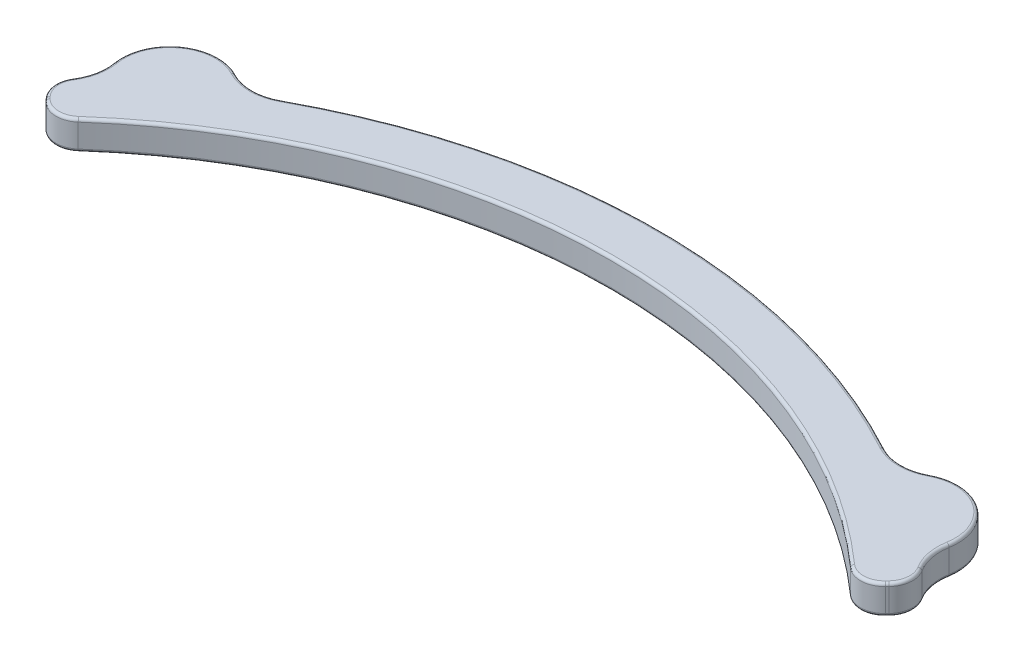
from build123d import *

# Parameters (mm, degrees)
EXTRUDE_1_DEPTH = 3
EXTRUDE_2_DEPTH = 3
FILLET_3_R      = 5
FILLET_1_R      = 2.5
FILLET_2_R      = 0.3


with BuildPart() as part:
    # Эскиз1 → Бобышка-Вытянуть1 (new body)
    with BuildSketch(Plane(origin=(0, 0, 0), x_dir=(1, 0, 0), z_dir=(0, 1, 0))):
        with BuildLine():
            Line((-45, 46.904157598234306), (-41.53846153846153, 43.29614547529319))
            ThreePointArc((-41.53846153846153, 43.29614547529319), (3.67e-15, 60), (41.53846153846155, 43.29614547529319))
            Line((41.53846153846155, 43.29614547529319), (45, 46.904157598234306))
            ThreePointArc((45, 46.904157598234306), (3.98e-15, 65.00000000000001), (-45, 46.904157598234306))
        make_face()
    extrude(amount=EXTRUDE_1_DEPTH)

    # Эскиз2 → Бобышка-Вытянуть2 (add)
    with BuildSketch(Plane(origin=(0, 3, 0), x_dir=(1, 0, 0), z_dir=(0, 1, 0))):
        with BuildLine():
            Line((-42.02974987239072, 49.583264572477226), (-33.93309379020482, 55.439563001751424))
            ThreePointArc((-33.93309379020482, 55.439563001751424), (-41.02444375843438, 56.71855969884159), (-42.02974987239072, 49.583264572477226))
        make_face()
    extrude_2 = extrude(amount=-EXTRUDE_2_DEPTH)

    # Зеркальное отражение1: Бобышка-Вытянуть2 across plane
    add(extrude_2.mirror(Plane(origin=(0, 0, 0), x_dir=(0, 0, 1), z_dir=(1, 0, 0))))

    # Скругление3
    fillet_3_edges = [part.edges().sort_by_distance(p)[0] for p in [
        (-42.02974987239072, 1.5, -49.583264572477226),
        (-33.93309379020482, 1.5, -55.439563001751424),
        (42.02974987239072, 1.5, -49.583264572477226),
        (33.93309379020482, 1.5, -55.439563001751424),
    ]]
    fillet(fillet_3_edges, radius=FILLET_3_R)

    # Скругление1
    fillet_1_edges = [part.edges().sort_by_distance(p)[0] for p in [
        (-45.00000000000001, 1.5, -46.904157598234306),
        (-41.53846153846153, 1.5, -43.29614547529319),
        (45, 1.5, -46.904157598234306),
        (41.53846153846155, 1.5, -43.29614547529319),
    ]]
    fillet(fillet_1_edges, radius=FILLET_1_R - 0.0001)  # a hair under: the kernel refuses the full size

    # Скругление2
    fillet_2_edges = [part.edges().sort_by_distance(p)[0] for p in [
        (41.02444375843438, 0, -56.71855969884159),
        (41.02444375843438, 3, -56.71855969884159),
        (7.11e-15, 0, -65.00000000000001),
        (7.11e-15, 3, -65.00000000000001),
        (-41.02444375843439, 0, -56.71855969884159),
        (-41.02444375843439, 3, -56.71855969884159),
        (43.05092646297095, 0, -50.01169135950295),
        (33.39115614651435, 3, -56.5073672828282),
        (33.39115614651436, 0, -56.5073672828282),
        (-33.39115614651442, 3, -56.507367282828206),
        (-33.39115614651442, 0, -56.507367282828206),
        (-43.05092646297095, 3, -50.01169135950294),
        (-43.32649192788036, 0, -45.15983567919837),
        (-43.32649192788036, 3, -45.15983567919837),
        (43.32649192788038, 0, -45.15983567919839),
        (0, 0, -60),
        (-43.05092646297095, 0, -50.01169135950294),
        (41.53237029407291, 0, -44.296859977676405),
        (44.10182670999084, 0, -46.73582398498882),
        (-41.532370294072905, 0, -44.29685997767639),
        (-44.10182670999084, 0, -46.7358239849889),
        (43.050926462970956, 3, -50.01169135950295),
        (0, 3, -60),
        (43.32649192788038, 3, -45.15983567919839),
        (41.53237029407291, 3, -44.296859977676405),
        (44.10182670999084, 3, -46.73582398498882),
        (-41.532370294072905, 3, -44.29685997767639),
        (-44.10182670999083, 3, -46.735823984988905),
    ]]
    fillet(fillet_2_edges, radius=FILLET_2_R)


solid = part.part
